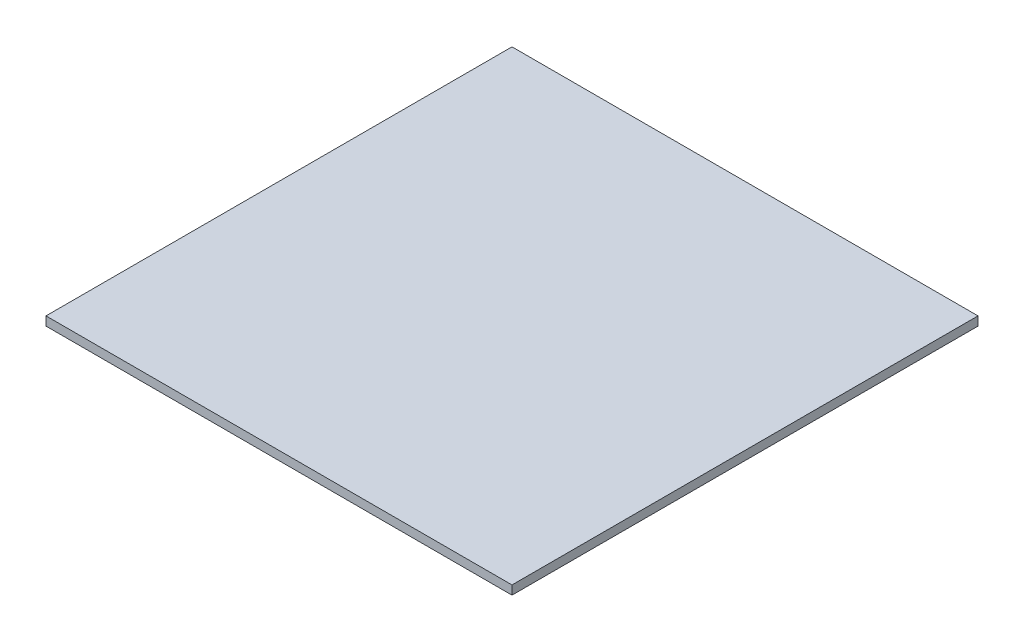
from build123d import *

# Parameters (mm, degrees)
SKETCH_1_W      = 210
SKETCH_1_H      = 210
EXTRUDE_1_DEPTH = 4


with BuildPart() as part:
    # Эскиз1 → Бобышка-Вытянуть1 (new body)
    with BuildSketch(Plane(origin=(0, 0, 0), x_dir=(1, 0, 0), z_dir=(0, 1, 0))):
        Rectangle(SKETCH_1_W, SKETCH_1_H)
    extrude(amount=EXTRUDE_1_DEPTH)


solid = part.part
